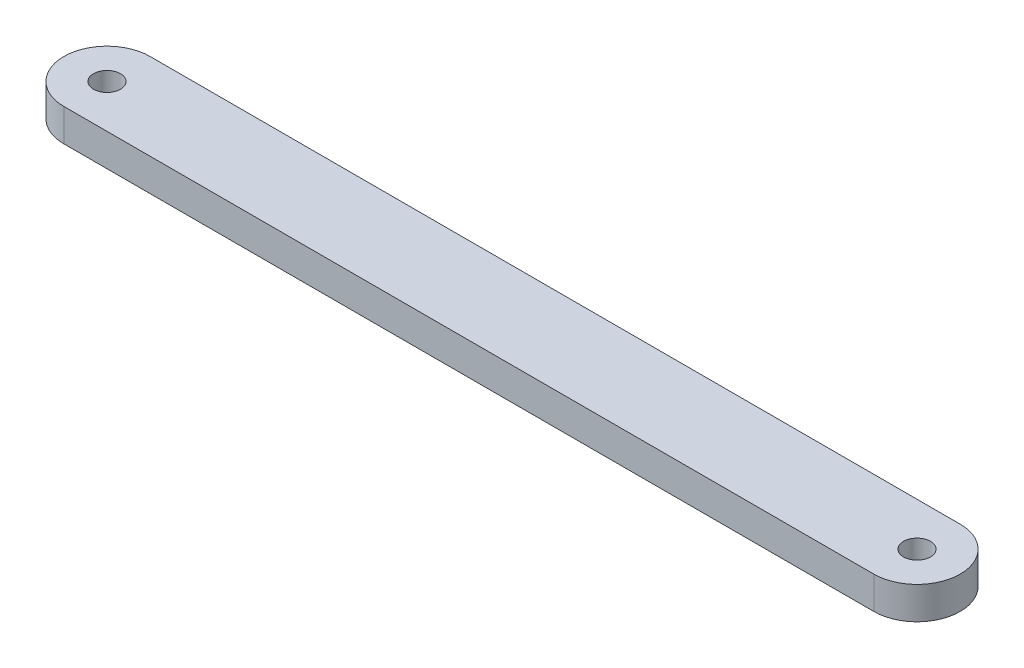
from build123d import *

# Parameters (mm, degrees)
SKETCH2_R           = 2.5
BOSS_EXTRUDE1_DEPTH = 6


with BuildPart() as part:
    # Sketch2 → Boss-Extrude1 (new body)
    with BuildSketch(Plane(origin=(0, 0, 0), x_dir=(1, 0, 0), z_dir=(0, 1, 0))):
        with BuildLine():
            Line((75, -8), (-75, -8))
            ThreePointArc((-75, -8), (-83, 0), (-75, 8))
            Line((-75, 8), (75, 8))
            ThreePointArc((75, 8), (83, 0), (75, -8))
        make_face()
        with Locations((75, 0)):
            Circle(SKETCH2_R, mode=Mode.SUBTRACT)
        with Locations((-75, 0)):
            Circle(SKETCH2_R, mode=Mode.SUBTRACT)
    extrude(amount=BOSS_EXTRUDE1_DEPTH)


solid = part.part
